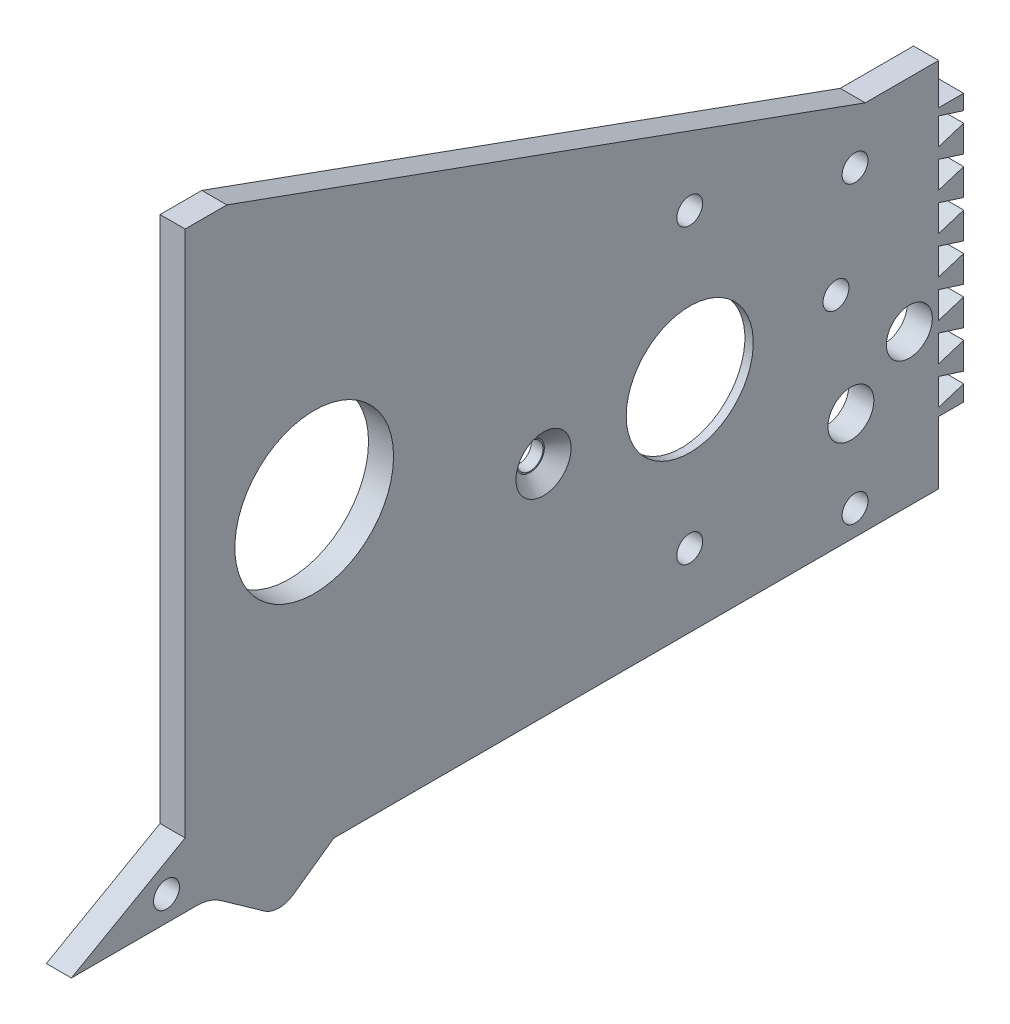
from build123d import *

# Parameters (mm, degrees)
EXTRUDE_1_DEPTH         = 3
SKETCH_3_R              = 7.6
SKETCH_3_R_2            = 9.5
SKETCH_3_R_3            = 1.55
CUT_EXTRUDE_1_DEPTH     = 112.843640856
SKETCH_4_R              = 13.75
CUT_EXTRUDE_2_DEPTH     = 2
EXTRUDE_6_DEPTH         = 3
SKETCH_10_R             = 1.55
CUT_EXTRUDE_3_DEPTH     = 124.991771172
CUT_EXTRUDE_6_DEPTH     = 124.991771172
EXTRUDE_7_DEPTH         = 3
CUT_EXTRUDE_7_DEPTH     = 124.991771172
SKETCH_18_W             = 9.7
SKETCH_18_H             = 35
CUT_EXTRUDE_9_DEPTH     = 124.991771172
SKETCH_19_R             = 1.55
CUT_EXTRUDE_10_DEPTH    = 124.991771172
SKETCH_20_W             = 61.573881036
SKETCH_20_H             = 3.2
SKETCH_20_W_2           = 79.598608315
SKETCH_20_H_2           = 1.2
EXTRUDE_8_DEPTH         = 3
EXTRUDE_START           = -3
EXTRUDE_9_DEPTH         = 3
EXTRUDE_11_DEPTH        = 3
SKETCH_25_R             = 9.5
EXTRUDE_12_DEPTH        = 3
SKETCH_26_R             = 9.5
CUT_EXTRUDE_11_DEPTH    = 124.991771172
EXTRUDE_13_DEPTH        = 3
CUT_EXTRUDE_12_DEPTH    = 3
SKETCH_29_W             = 5.5
SKETCH_29_H             = 32
EXTRUDE_14_DEPTH        = 3
SKETCH_32_W             = 9.716106013
SKETCH_32_H             = 6
CUT_EXTRUDE_13_DEPTH    = 124.991771172
CUT_EXTRUDE_16_DEPTH    = 3
SKETCH_35_W             = 2.5
SKETCH_35_H             = 44.4
EXTRUDE_15_DEPTH        = 3
SKETCH_36_R             = 1.55
CUT_EXTRUDE_14691_DEPTH = 3
EXTRUDE_16_DEPTH        = 3
SKETCH_38_R             = 2.75
CUT_EXTRUDE_L_DEPTH     = 121.232106085
SKETCH_57_R             = 1.55
EXTRUDE_17_DEPTH        = 3
CUT_EXTRUDE_17_DEPTH    = 121.232106085


# Read off the part's stored shape, not the designer's step: 高级异型孔6
with BuildPart() as part:
    # 草图1 → 凸台-拉伸1 (new body)
    with BuildSketch(Plane(origin=(0, 0, 0), x_dir=(0, 0, -1), z_dir=(1, 0, 0))):
        Polygon((0, -50), (18.610302832, -39.45792997), (18.610302832, 40), (58.496702951, 40), (58.496702951, 0), (100, 0), (100, -50), align=None)
    extrude(amount=EXTRUDE_1_DEPTH)

    # 草图3 → 切除-拉伸1 (cut, through all)
    with BuildSketch(Plane.ZY):
        with Locations((-74, -24.961577338)):
            Circle(SKETCH_3_R)
        with Locations((-34.176393222, 0)):
            Circle(SKETCH_3_R_2)
        with Locations((-74, -7.461577338)):
            Circle(SKETCH_3_R_3)
        with Locations((-56.5, -24.961577338)):
            Circle(SKETCH_3_R_3)
        with Locations((-74, -42.461577338)):
            Circle(SKETCH_3_R_3)
        with Locations((-91.5, -24.961577338)):
            Circle(SKETCH_3_R_3)
    extrude(amount=-CUT_EXTRUDE_1_DEPTH, mode=Mode.SUBTRACT)

    # 草图4 → 切除-拉伸2 (cut)
    with BuildSketch(Plane.ZY):
        with Locations((-74, -24.961577338)):
            Circle(SKETCH_4_R)
    extrude(amount=-CUT_EXTRUDE_2_DEPTH, mode=Mode.SUBTRACT)

    # 草图6 → 凸台-拉伸6 (add)
    with BuildSketch(Plane.ZY):
        with BuildLine():
            Line((-102.983893987, -45.2), (-110.983893987, -45.2))
            Line((-110.983893987, -45.2), (-111, -50))
            Line((-111, -50), (-100, -50))
            Line((-100, -50), (-100, 0))
            Line((-100, 0), (-110.983893987, 0))
            Line((-110.983893987, 0), (-110.983893987, -6.8))
            Line((-110.983893987, -6.8), (-102.983893987, -6.8))
            ThreePointArc((-102.983893987, -6.8), (-101.283893987, -8.5), (-102.983893987, -10.2))
            Line((-102.983893987, -10.2), (-110.983893987, -10.2))
            Line((-110.983893987, -10.2), (-110.983893987, -41.8))
            Line((-110.983893987, -41.8), (-102.983893987, -41.8))
            ThreePointArc((-102.983893987, -41.8), (-101.283893987, -43.5), (-102.983893987, -45.2))
        make_face()
        with BuildLine():
            Line((-15.00347976, -50), (-34.686448159, -50))
            ThreePointArc((-34.686448159, -50), (-33.16855591, -50.235967767), (-31.793933119, -50.921598751))
            Line((-31.793933119, -50.921598751), (-26.580472983, -54.619128968))
            ThreePointArc((-26.580472983, -54.619128968), (-25.755699309, -55.030507559), (-24.844963959, -55.172088219))
            ThreePointArc((-24.844963959, -55.172088219), (-23.93422861, -55.030507559), (-23.109454935, -54.619128968))
            Line((-23.109454935, -54.619128968), (-17.8959948, -50.921598751))
            ThreePointArc((-17.8959948, -50.921598751), (-16.521372009, -50.235967767), (-15.00347976, -50))
        make_face()
    extrude(amount=-EXTRUDE_6_DEPTH)

    # 草图10 → 切除-拉伸3 (cut, through all)
    with BuildSketch(Plane.ZY):
        with Locations((-105.983893987, -15.2)):
            Circle(SKETCH_10_R)
        with Locations((-105.983893987, -36.8)):
            Circle(SKETCH_10_R)
    extrude(amount=-CUT_EXTRUDE_3_DEPTH, mode=Mode.SUBTRACT)

    # 草图14 → 切除-拉伸6 (cut, through all)
    with BuildSketch(Plane(origin=(3, 0, 0), x_dir=(0, 0, -1), z_dir=(1, 0, 0))):
        with BuildLine():
            Line((58.496702951, 0), (58.496702951, 40))
            Line((58.496702951, 40), (18.610302832, 40))
            Line((18.610302832, 40), (18.610302832, 18.686206016))
            ThreePointArc((18.610302832, 18.686206016), (44.493983197, 22.023278649), (58.496702951, 0))
        make_face()
    extrude(amount=-CUT_EXTRUDE_6_DEPTH, mode=Mode.SUBTRACT)

    # 草图15 → 凸台-拉伸7 (add)
    with BuildSketch(Plane(origin=(3, 0, 0), x_dir=(0, 0, -1), z_dir=(1, 0, 0))):
        with BuildLine():
            Line((18.610302832, 18.686206016), (18.610302832, -18.686206016))
            ThreePointArc((18.610302832, -18.686206016), (9.856083494, 0), (18.610302832, 18.686206016))
        make_face()
    extrude(amount=-EXTRUDE_7_DEPTH)

    # 草图16 → 切除-拉伸7 (cut, through all)
    with BuildSketch(Plane(origin=(3, 0, 0), x_dir=(0, 0, -1), z_dir=(1, 0, 0))):
        with BuildLine():
            Line((18.610302832, -18.686206016), (18.610302832, 0))
            ThreePointArc((18.610302832, 0), (34.176393222, 15.56609039), (49.742483613, 0))
            Line((49.742483613, 0), (58.496702951, 0))
            ThreePointArc((58.496702951, 0), (23.858803248, 22.023278649), (18.610302832, -18.686206016))
        make_face()
    extrude(amount=-CUT_EXTRUDE_7_DEPTH, mode=Mode.SUBTRACT)

    # 草图18 → 切除-拉伸9 (cut, through all)
    with BuildSketch(Plane.ZY):
        with Locations((-106.133893987, -26)):
            Rectangle(SKETCH_18_W, SKETCH_18_H)
    extrude(amount=-CUT_EXTRUDE_9_DEPTH, mode=Mode.SUBTRACT)

    # 草图19 → 切除-拉伸10 (cut, through all)
    with BuildSketch(Plane.ZY):
        with Locations((-105.983893987, -1.8)):
            Circle(SKETCH_19_R)
        with Locations((-105.993932098, -48.2)):
            Circle(SKETCH_19_R)
    extrude(amount=-CUT_EXTRUDE_10_DEPTH, mode=Mode.SUBTRACT)

    # 草图20 → 凸台-拉伸8 (add)
    with BuildSketch(Plane.ZY):
        with Locations((-80.196953469, 1.6)):
            Rectangle(SKETCH_20_W, SKETCH_20_H)
        with Locations((-71.200695842, -50.6)):
            Rectangle(SKETCH_20_W_2, SKETCH_20_H_2)
    extrude(amount=-EXTRUDE_8_DEPTH)

    # 草图22 → 凸台-拉伸9 (add)
    with BuildSketch(Plane.ZY.offset(EXTRUDE_START)):
        with BuildLine():
            Line((-18.610302832, 0), (-18.610302832, 25))
            Line((-18.610302832, 25), (-41.044918155, 13.968769999))
            ThreePointArc((-41.044918155, 13.968769999), (-25.948784515, 13.213993529), (-18.610302832, 0))
        make_face()
    extrude(amount=EXTRUDE_9_DEPTH)

    # 草图24 → 凸台-拉伸11 (add)
    with BuildSketch(Plane.ZY):
        Polygon((-18.610302832, 25), (-70.983893987, 3.2), (-49.410012951, 3.2), align=None)
    extrude(amount=-EXTRUDE_11_DEPTH)

    # 草图25 → 凸台-拉伸12 (add, through all)
    with BuildSketch(Plane(origin=(3, 0, 0), x_dir=(0, 0, -1), z_dir=(1, 0, 0))):
        with Locations((34.176393222, 0)):
            Circle(SKETCH_25_R)
    extrude(amount=-EXTRUDE_12_DEPTH)

    # 草图26 → 切除-拉伸11 (cut, through all)
    with BuildSketch(Plane(origin=(3, 0, 0), x_dir=(0, 0, -1), z_dir=(1, 0, 0))):
        with Locations((29.059828781, -15.2)):
            Circle(SKETCH_26_R)
    extrude(amount=-CUT_EXTRUDE_11_DEPTH, mode=Mode.SUBTRACT)

    # 草图27 → 凸台-拉伸13 (add)
    with BuildSketch(Plane.ZY):
        Polygon((-18.610302832, -10.2), (-13.610302832, -15.2), (-18.610302832, -20.2), align=None)
    extrude(amount=-EXTRUDE_13_DEPTH)

    # 草图28 → 切除-拉伸12 (cut)
    with BuildSketch(Plane.ZY):
        Polygon((-110.983893987, 3.2), (-101.283893987, 3.2), (-70.983893987, 3.2), (-95.008477086, -6.8), (-101.283893987, -6.8), (-101.283893987, -45.2), (-110.983893987, -45.2), align=None)
    extrude(amount=-CUT_EXTRUDE_12_DEPTH, mode=Mode.SUBTRACT)

    # 草图29 → 凸台-拉伸14 (add)
    with BuildSketch(Plane.ZY):
        with Locations((-104.033893987, -27.7)):
            Rectangle(SKETCH_29_W, SKETCH_29_H)
    extrude(amount=-EXTRUDE_14_DEPTH)

    # 草图32 → 切除-拉伸13 (cut, through all)
    with BuildSketch(Plane.ZY):
        with Locations((-106.141946993, -48.2)):
            Rectangle(SKETCH_32_W, SKETCH_32_H)
    extrude(amount=-CUT_EXTRUDE_13_DEPTH, mode=Mode.SUBTRACT)

    # 草图34 → 切除-拉伸16 (cut)
    with BuildSketch(Plane.ZY):
        Polygon((-103.783893987, -15.75), (-103.783893987, -12.55), (-106.783893987, -13.5), (-106.783893987, -14.8), align=None)
        Polygon((-106.783893987, -18), (-106.783893987, -19.3), (-103.783893987, -20.25), (-103.783893987, -17.05), align=None)
        Polygon((-106.783893987, -22.5), (-106.783893987, -23.8), (-103.783893987, -24.75), (-103.783893987, -21.55), align=None)
        Polygon((-106.783893987, -27), (-106.783893987, -28.3), (-103.783893987, -29.25), (-103.783893987, -26.05), align=None)
        Polygon((-106.783893987, -31.5), (-106.783893987, -32.8), (-103.783893987, -33.75), (-103.783893987, -30.55), align=None)
        Polygon((-106.783893987, -36), (-106.783893987, -37.3), (-103.783893987, -38.25), (-103.783893987, -35.05), align=None)
        Polygon((-106.783893987, -40.5), (-106.783893987, -41.8), (-103.783893987, -42.75), (-103.783893987, -39.55), align=None)
    extrude(amount=-CUT_EXTRUDE_16_DEPTH, mode=Mode.SUBTRACT)

    # 草图35 → 凸台-拉伸15 (add, through all)
    with BuildSketch(Plane.ZY):
        with Locations((-102.533893987, -29)):
            Rectangle(SKETCH_35_W, SKETCH_35_H)
    extrude(amount=-EXTRUDE_15_DEPTH)

    # 草图36 → Cut-Extrude 14691 (cut)
    with BuildSketch(Plane.ZY):
        with Locations((-93.783893987, -48.2)):
            Circle(SKETCH_36_R)
        with Locations(Location((-93.783893987, -12.9, 0), (0, 0, 180))):
            Circle(SKETCH_36_R)
        with Locations((-21.610302832, 20.501770791)):
            Circle(SKETCH_36_R)
        with Locations((-11.382694019, -47)):
            Circle(SKETCH_36_R)
    extrude(amount=-CUT_EXTRUDE_14691_DEPTH, mode=Mode.SUBTRACT)

    # 草图37 → 凸台-拉伸16 (add)
    with BuildSketch(Plane.ZY):
        Polygon((-13.610302832, -39.45792997), (-13.610302832, -42.290250896), (-18.610302832, -39.45792997), (-18.610302832, 25), (-13.610302832, 25), align=None)
    extrude(amount=-EXTRUDE_16_DEPTH)

    # 草图38 → L型支架定位孔 (cut, through all)
    with BuildSketch(Plane(origin=(3, 0, 0), x_dir=(0, 0, -1), z_dir=(1, 0, 0))):
        with Locations((93.283893987, -38.15)):
            Circle(SKETCH_38_R)
        with Locations((100.283893987, -33.15)):
            Circle(SKETCH_38_R)
    extrude(amount=-CUT_EXTRUDE_L_DEPTH, mode=Mode.SUBTRACT)

    # 高级异型孔6 outline → 高级异型孔6 (revolve, cut)
    with BuildSketch(Plane(origin=(0, -24.961577338, -56.5), x_dir=(0, 1, 0), z_dir=(0, 0, -1))):
        Polygon((1.55, 3), (1.55, 1.4), (1.7, 1.4), (3.3, 3), align=None)
    revolve(axis=Axis((0, -24.961577338, -56.5), (1, 0, 0)), mode=Mode.SUBTRACT)

    # 草图57 → 凸台-拉伸17 (add, through all)
    with BuildSketch(Plane.ZY):
        with Locations((-21.610302832, 20.501770791)):
            Circle(SKETCH_57_R)
    extrude(amount=-EXTRUDE_17_DEPTH)

    # 草图56 → 切除-拉伸17 (cut, through all)
    with BuildSketch(Plane.ZY):
        Polygon((-95.008477086, -6.8), (-18.610302832, 20.82), (-13.610302832, 20.82), (-13.610302832, 25), (-18.610302832, 25), align=None)
    extrude(amount=-CUT_EXTRUDE_17_DEPTH, mode=Mode.SUBTRACT)


solid = part.part
